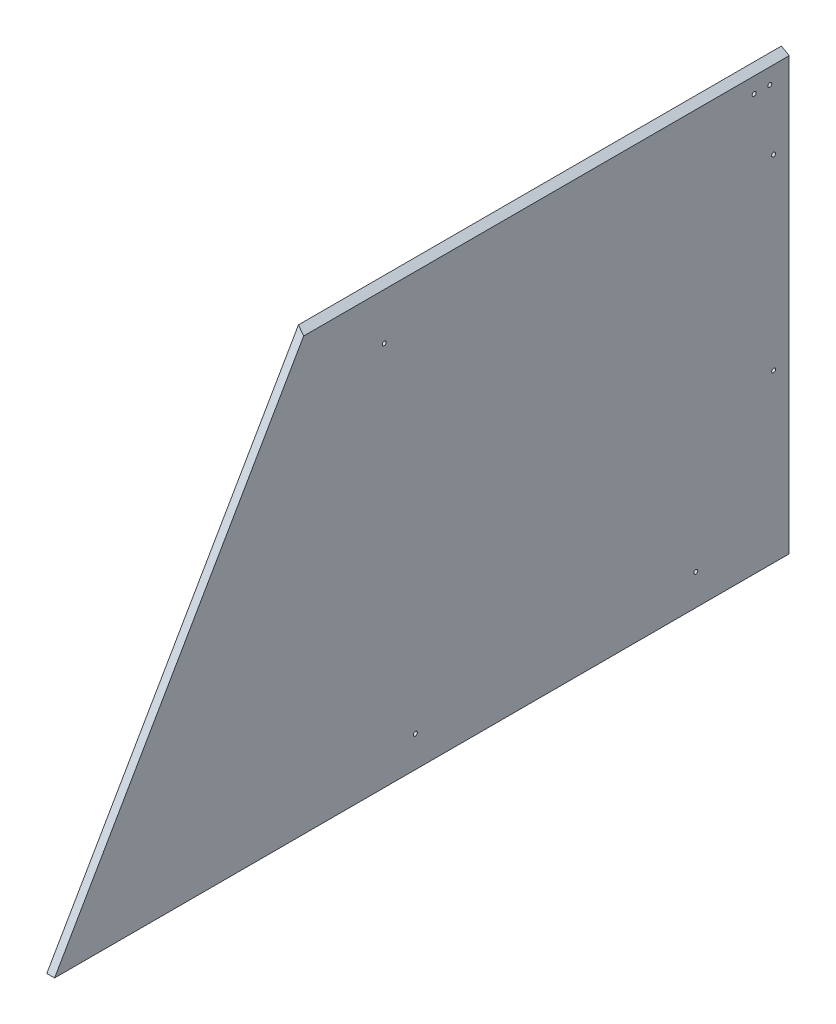
from build123d import *

# Parameters (mm, degrees)
BOSS_EXTRUDE1_DEPTH                            = 6.35
CHAMFER1_SIZE                                  = 6.6548
CHAMFER1_SIZE_2                                = 3.842150571
CSK_FOR_4_FLAT_HEAD_MACHINE_SCREW1_D           = 3.2639
CSK_FOR_4_FLAT_HEAD_MACHINE_SCREW1_CSINK_D     = 5.715
CSK_FOR_4_FLAT_HEAD_MACHINE_SCREW1_CSINK_ANGLE = 82
CSK_FOR_4_FLAT_HEAD_MACHINE_SCREW2_D           = 3.2639
CSK_FOR_4_FLAT_HEAD_MACHINE_SCREW2_CSINK_D     = 5.715
CSK_FOR_4_FLAT_HEAD_MACHINE_SCREW2_CSINK_ANGLE = 82
CSK_FOR_4_FLAT_HEAD_MACHINE_SCREW3_D           = 3.2639
CSK_FOR_4_FLAT_HEAD_MACHINE_SCREW3_CSINK_D     = 5.715
CSK_FOR_4_FLAT_HEAD_MACHINE_SCREW3_CSINK_ANGLE = 82


with BuildPart() as part:
    # Sketch1 → Boss-Extrude1 (new body)
    with BuildSketch(Plane(origin=(0, 0, 0), x_dir=(0, 0, -1), z_dir=(1, 0, 0))):
        Polygon((-39.465115344, -250.191197903), (165.84064038, 105.408802097), (559.54064038, 105.408802097), (559.54064038, -250.191197903), align=None)
    extrude(amount=BOSS_EXTRUDE1_DEPTH)

    # Chamfer1
    # the kernel refuses this chamfer: 6.6548, 3.842150571 mm, written as the material it takes off along each edge
    with BuildSketch(Plane(origin=(6.35, 105.408802097, -148.6241021), x_dir=(-0.9998132206222078, 0.019326765612699946, 0), z_dir=(0, 0, -1))) as chamfer1_piece_1:
        Polygon((CHAMFER1_SIZE * 0.999813220622, -CHAMFER1_SIZE * 0.0193267656127), (-CHAMFER1_SIZE_2 * 0.0193267656147, -CHAMFER1_SIZE_2 * 0.999813220727), (0, 0), align=None)
    extrude(amount=428.13307656, mode=Mode.SUBTRACT)

    # CSK for #4 Flat Head Machine Screw1 (through all)
    with Locations(Plane(origin=(0, 38.098802097, -546.84064038), x_dir=(0, 0, -1), z_dir=(-1, 0, 0))):
        with Locations((0, 0), (-317.5, -25.4), (0, 152.4)):
            CounterSinkHole(CSK_FOR_4_FLAT_HEAD_MACHINE_SCREW1_D / 2, CSK_FOR_4_FLAT_HEAD_MACHINE_SCREW1_CSINK_D / 2, counter_sink_angle=CSK_FOR_4_FLAT_HEAD_MACHINE_SCREW1_CSINK_ANGLE)

    # CSK for #4 Flat Head Machine Screw2 (through all)
    with Locations(Plane.ZY):
        with Locations((-543.66564038, 88.866651525), (-530.96564038, 88.866651525)):
            CounterSinkHole(CSK_FOR_4_FLAT_HEAD_MACHINE_SCREW2_D / 2, CSK_FOR_4_FLAT_HEAD_MACHINE_SCREW2_CSINK_D / 2, counter_sink_angle=CSK_FOR_4_FLAT_HEAD_MACHINE_SCREW2_CSINK_ANGLE)

    # CSK for #4 Flat Head Machine Screw3 (through all)
    with Locations(Plane(origin=(0, -224.791197903, -483.34064038), x_dir=(0, 0, -1), z_dir=(-1, 0, 0))):
        with Locations((0, 0), (-228.6, 0)):
            CounterSinkHole(CSK_FOR_4_FLAT_HEAD_MACHINE_SCREW3_D / 2, CSK_FOR_4_FLAT_HEAD_MACHINE_SCREW3_CSINK_D / 2, counter_sink_angle=CSK_FOR_4_FLAT_HEAD_MACHINE_SCREW3_CSINK_ANGLE)


solid = part.part
